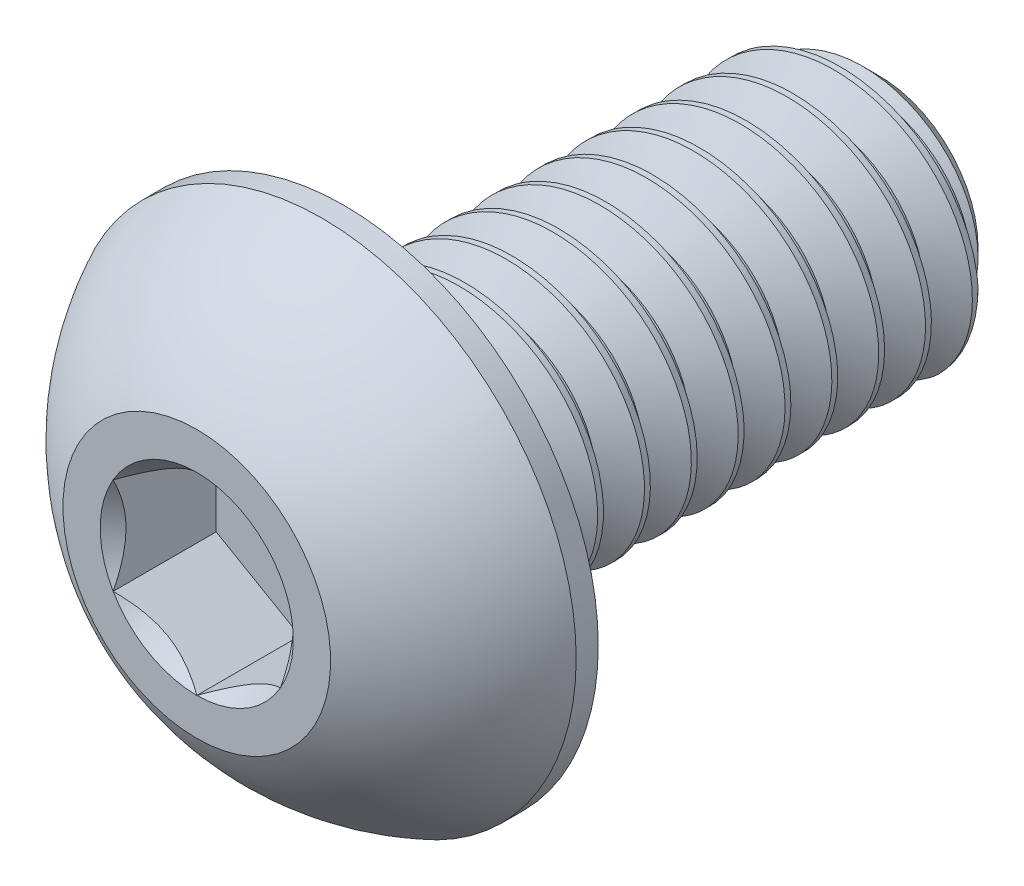
from build123d import *

# Parameters (mm, degrees)
CUT_EXTRUDE2_DEPTH = 1.54
CUT_SWEEP2_PITCH   = 0.7
CUT_SWEEP2_TO      = 8


with BuildPart() as part:
    # Sketch10 → Revolve3 (revolve)
    with BuildSketch(Plane(origin=(0, 0, 0), x_dir=(0, 0, -1), z_dir=(1, 0, 0)), mode=Mode.PRIVATE) as revolve3_sk:
        Polygon((9.675, 2), (10.2, 1.475), (10.2, 0), (2.2, 0), (2.2, 2), align=None)
    revolve(revolve3_sk.sketch.rotate(Axis((0, 0, 0), (0, 0, -1)), 90), axis=Axis((0, 0, 0), (0, 0, -1)))

    # Sketch7 → Revolve2 (revolve)
    with BuildSketch(Plane(origin=(0, 0, 0), x_dir=(0, 0, -1), z_dir=(1, 0, 0)), mode=Mode.PRIVATE) as revolve2_sk:
        with BuildLine():
            Line((1.87, 3.8), (2.2, 3.8))
            Line((2.2, 3.8), (2.2, 0))
            Line((2.2, 0), (0, 0))
            Line((0, 0), (0, 2))
            ThreePointArc((0, 2), (0.793500147, 3.047002626), (1.87, 3.8))
        make_face()
    revolve(revolve2_sk.sketch.rotate(Axis((0, 0, 0), (0, 0, -1)), 180), axis=Axis((0, 0, 0), (0, 0, -1)))

    # Sketch5 → Cut-Extrude2 (cut)
    with BuildSketch(Plane.XY):
        Polygon((1.25, -0.721687836), (1.25, 0.721687836), (0, 1.443375673), (-1.25, 0.721687836), (-1.25, -0.721687836), (0, -1.443375673), align=None)
    extrude(amount=-CUT_EXTRUDE2_DEPTH, mode=Mode.SUBTRACT)

    # Cut-Extrude3 cone 1 section (through the dimple's axis) → Cut-Extrude3 (revolve, cut)
    with BuildSketch(Plane(origin=(0, 0, 0), x_dir=(0, -1, 0), z_dir=(1, 0, 0))):
        Polygon((0, 0), (1.443375673, 0), (0, 1.443375673), align=None)
    revolve(axis=Axis((0, 0, 0), (0, 0, -1)), mode=Mode.SUBTRACT)


with BuildPart() as body_2:
    # Split1: read off the stored shape, not the designer's step
    # Split1: the piece on the far side of the plane
    add(part.part)
    split(bisect_by=Plane.XY.offset(-2.2), keep=Keep.BOTTOM)

    # Cut-Sweep2: arcs per turn and ends read off the stored shape
    # Cut-Sweep2: the profile of Sketch12 screwed along a right-hand helix through 15.666667 turns, 6 arcs to a turn; built about Z, then put on its axis
    cut_sweep2_z = Axis((0, 0, 0), (0, 0, 1))
    cut_sweep2_corners = [(1.545336663, 0, -0.2625), (1.545336663, 0, -0.35), (2.037888611, 0, -0.634375), (2.037888611, 0, 0.021875)]
    with BuildLine(mode=Mode.PRIVATE) as cut_sweep2_profile:
        Line(cut_sweep2_corners[0], cut_sweep2_corners[1])
        Line(cut_sweep2_corners[1], cut_sweep2_corners[2])
        Line(cut_sweep2_corners[2], cut_sweep2_corners[3])
        Line(cut_sweep2_corners[3], cut_sweep2_corners[0])
    cut_sweep2_cap = Face(cut_sweep2_profile.wire())
    cut_sweep2_turn_angles = [0, 30, 60, 90, 120, 150, 180, 210, 240, 270, 300, 330, 360]
    cut_sweep2_turn_weights = [1, 0.8660254037844387, 1, 0.8660254037844387, 1, 0.8660254037844387, 1, 0.8660254037844387, 1, 0.8660254037844387, 1, 0.8660254037844387, 1]
    cut_sweep2_turn_rails = [Edge.make_bspline([Vector(p[0], p[1], 0).rotate(cut_sweep2_z, cut_sweep2_turn_angles[k]) / cut_sweep2_turn_weights[k] + Vector(0, 0, p[2] + CUT_SWEEP2_PITCH * cut_sweep2_turn_angles[k] / 360) for k in range(13)], [0, 0, 0, 1, 1, 2, 2, 3, 3, 4, 4, 5, 5, 6, 6, 6], 2, cut_sweep2_turn_weights) for p in cut_sweep2_corners]
    cut_sweep2_turn_sides = [Face.make_surface_from_curves(cut_sweep2_turn_rails[p[0]], cut_sweep2_turn_rails[p[1]]) for p in [(0, 1), (1, 2), (2, 3), (3, 0)]]
    cut_sweep2_last_angles = [5400, 5430, 5460, 5490, 5520, 5550, 5580, 5610, 5640]
    cut_sweep2_last_weights = [1, 0.8660254037844387, 1, 0.8660254037844387, 1, 0.8660254037844387, 1, 0.8660254037844387, 1]
    cut_sweep2_last_rails = [Edge.make_bspline([Vector(p[0], p[1], 0).rotate(cut_sweep2_z, cut_sweep2_last_angles[k]) / cut_sweep2_last_weights[k] + Vector(0, 0, p[2] + CUT_SWEEP2_PITCH * cut_sweep2_last_angles[k] / 360) for k in range(9)], [0, 0, 0, 1, 1, 2, 2, 3, 3, 4, 4, 4], 2, cut_sweep2_last_weights) for p in cut_sweep2_corners]
    cut_sweep2_last_sides = [Face.make_surface_from_curves(cut_sweep2_last_rails[p[0]], cut_sweep2_last_rails[p[1]]) for p in [(0, 1), (1, 2), (2, 3), (3, 0)]]
    cut_sweep2 = Plane(origin=(0, 0, -10.2), x_dir=(0, 1, 0), z_dir=(0, 0, 1)) * split(Solid(Shell([*[p.moved(Location((0, 0, CUT_SWEEP2_PITCH * i))) for i in range(15) for p in cut_sweep2_turn_sides], *cut_sweep2_last_sides, cut_sweep2_cap, cut_sweep2_cap.rotate(cut_sweep2_z, 5640).moved(Location((0, 0, CUT_SWEEP2_PITCH * 5640 / 360)))])), bisect_by=Plane.XY.offset(CUT_SWEEP2_TO), keep=Keep.BOTTOM, mode=Mode.PRIVATE)
    add(cut_sweep2, mode=Mode.SUBTRACT)


with BuildPart() as part_1:
    add(part.part)

    # Split1
    split(bisect_by=Plane.XY.offset(-2.2), keep=Keep.TOP)

    add(body_2.part)  # Boss-Extrude1 merges body 2
    # Boss-Extrude1 cone 1 section (through the dimple's axis) → Boss-Extrude1 (revolve)
    with BuildSketch(Plane(origin=(0, 0, -2.2), x_dir=(0, -1, 0), z_dir=(1, 0, 0))):
        Polygon((0, 0), (2, 0), (0, 2), align=None)
    revolve(axis=Axis((0, 0, -2.2), (0, 0, -1)))


solid = part_1.part
